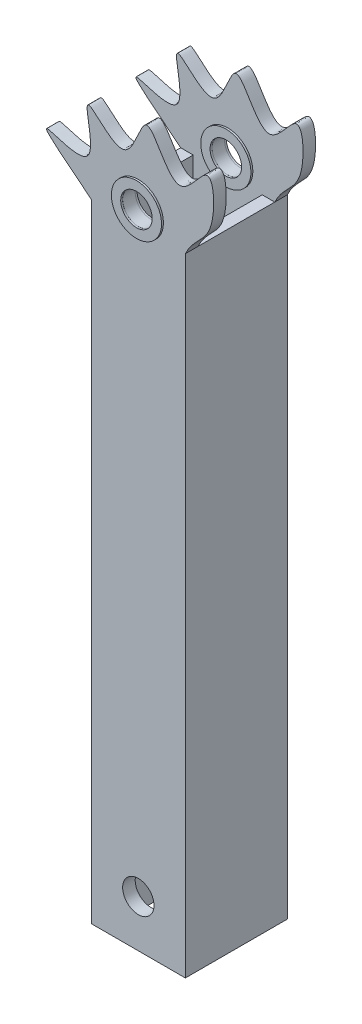
from build123d import *

# Parameters (mm, degrees)
SKETCH1_W            = 38.1
SKETCH1_H            = 254
BOSS_EXTRUDE1_DEPTH  = 20.6375
SKETCH2_W            = 27.94
SKETCH2_H            = 15.5575
CUT_EXTRUDE1_DEPTH   = 256.548055963
BOSS_EXTRUDE2_DEPTH  = 5.08
SKETCH4_R            = 6.35
CUT_EXTRUDE2_DEPTH   = 170.649061492
SKETCH7_R            = 10.16
SKETCH7_R_2          = 6.3754
BOSS_EXTRUDE7_DEPTH  = 0.762
BOSS_EXTRUDE8_START  = 0.762
SKETCH5_R            = 10.16
SKETCH5_R_2          = 6.3754
BOSS_EXTRUDE8_DEPTH  = 0.762
BOSS_EXTRUDE9_START  = 0.762
SKETCH8_R            = 10.16
SKETCH8_R_2          = 6.3754
BOSS_EXTRUDE9_DEPTH  = 0.762
SKETCH6_R            = 10.16
SKETCH6_R_2          = 6.3754
BOSS_EXTRUDE10_DEPTH = 0.762


with BuildPart() as part:
    # Sketch1 → Boss-Extrude1 (new body)
    with BuildSketch(Plane.XY):
        Rectangle(SKETCH1_W, SKETCH1_H)
    boss_extrude1 = extrude(amount=-BOSS_EXTRUDE1_DEPTH)

    # Sketch2 → Cut-Extrude1 (cut, through all)
    with BuildSketch(Plane(origin=(0, 127, 0), x_dir=(1, 0, 0), z_dir=(0, 1, 0))):
        with Locations((0, 12.85875)):
            Rectangle(SKETCH2_W, SKETCH2_H)
    cut_extrude1 = extrude(amount=-CUT_EXTRUDE1_DEPTH, mode=Mode.SUBTRACT)

    # Sketch3 → Boss-Extrude2 (add)
    with BuildSketch(Plane.XY):
        with BuildLine():
            Line((19.05, -127), (19.05, 127))
            add(Edge.make_bspline(
                [(-19.05, 127), (-56.075315262, 156.249850392), (-8.765115366, 122.455949853), (-26.712109458, 171.110128284), (-3.384581259, 140.1026882), (2.775851656, 177.747781306), (14.812642132, 138.429098192), (30.466954619, 168.517170498), (31.839042912, 136.04797914), (22.264682919, 133.908235623), (19.05, 127)],
                knots=[0, 0, 0, 0, 0.207464244, 0.325922959, 0.435664574, 0.542830686, 0.674868849, 0.767184926, 0.882236084, 1, 1, 1, 1], degree=3))
            Line((-19.05, 127), (-19.05, -127))
            Line((-19.05, -127), (19.05, -127))
        make_face()
    boss_extrude2 = extrude(amount=-BOSS_EXTRUDE2_DEPTH)

    # Sketch4 → Cut-Extrude2 (cut, through all)
    with BuildSketch(Plane.XY):
        with Locations((0, 133.35)):
            Circle(SKETCH4_R)
        with Locations((0, -107.95)):
            Circle(SKETCH4_R)
    cut_extrude2 = extrude(amount=-CUT_EXTRUDE2_DEPTH, mode=Mode.SUBTRACT)

    # Mirror1: Boss-Extrude1, Cut-Extrude1, Boss-Extrude2, Cut-Extrude2 across plane
    add(boss_extrude1.mirror(Plane.XY.offset(-20.6375)))
    add(cut_extrude1.mirror(Plane.XY.offset(-20.6375)), mode=Mode.SUBTRACT)
    add(boss_extrude2.mirror(Plane.XY.offset(-20.6375)))
    add(cut_extrude2.mirror(Plane.XY.offset(-20.6375)), mode=Mode.SUBTRACT)

    # Sketch7 → Boss-Extrude7 (add)
    with BuildSketch(Plane(origin=(0, 0, -5.08), x_dir=(-1, 0, 0), z_dir=(0, 0, -1))):
        with Locations((0, 133.35)):
            Circle(SKETCH7_R)
        with Locations((0, 133.35)):
            Circle(SKETCH7_R_2, mode=Mode.SUBTRACT)
    extrude(amount=BOSS_EXTRUDE7_DEPTH)

    # Sketch5 → Boss-Extrude8 (add)
    with BuildSketch(Plane.XY.offset(BOSS_EXTRUDE8_START)):
        with Locations((0, 133.35)):
            Circle(SKETCH5_R)
        with Locations((0, 133.35)):
            Circle(SKETCH5_R_2, mode=Mode.SUBTRACT)
    extrude(amount=-BOSS_EXTRUDE8_DEPTH)

    # Sketch8 → Boss-Extrude9 (add)
    with BuildSketch(Plane.XY.offset(-36.195).offset(BOSS_EXTRUDE9_START)):
        with Locations((0, 133.35)):
            Circle(SKETCH8_R)
        with Locations((0, 133.35)):
            Circle(SKETCH8_R_2, mode=Mode.SUBTRACT)
    extrude(amount=-BOSS_EXTRUDE9_DEPTH)

    # Sketch6 → Boss-Extrude10 (add)
    with BuildSketch(Plane(origin=(0, 0, -41.275), x_dir=(-1, 0, 0), z_dir=(0, 0, -1))):
        with Locations((0, 133.35)):
            Circle(SKETCH6_R)
        with Locations((0, 133.35)):
            Circle(SKETCH6_R_2, mode=Mode.SUBTRACT)
    extrude(amount=BOSS_EXTRUDE10_DEPTH)


solid = part.part
